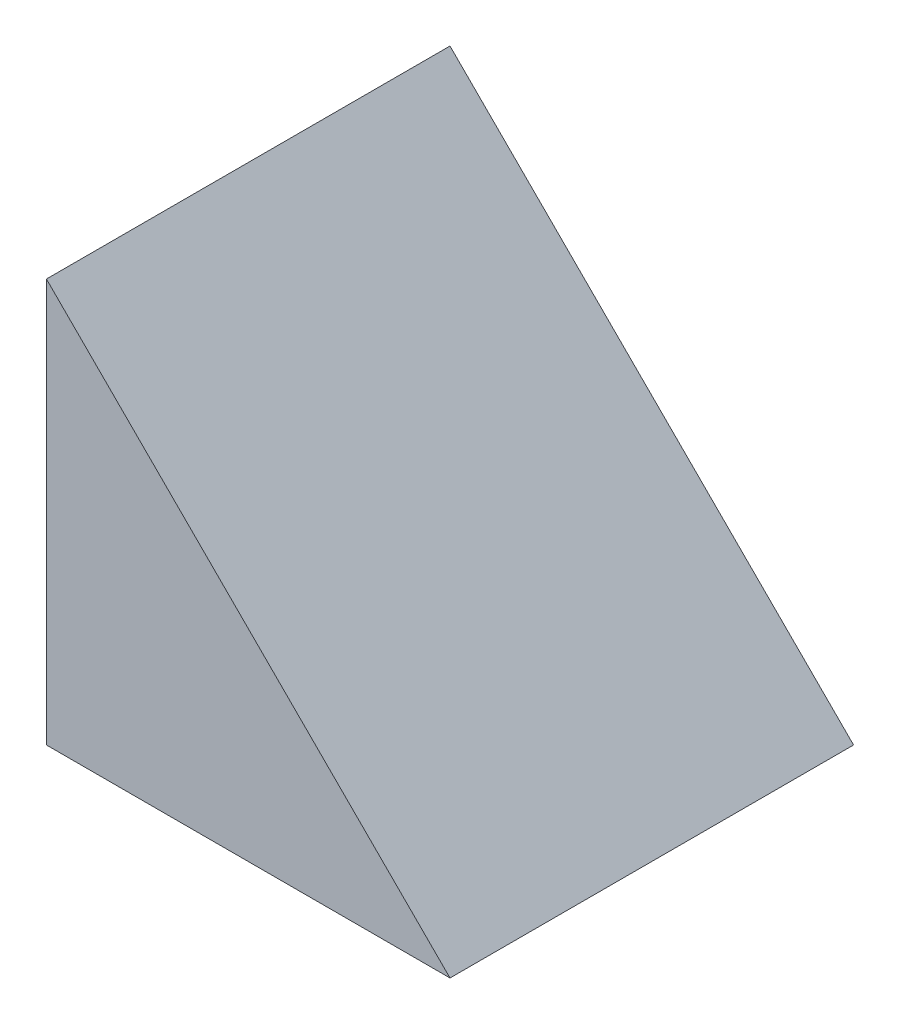
from build123d import *

# Parameters (mm, degrees)
BOSS_EXTRUDE1_DEPTH = 25.4


with BuildPart() as part:
    # Sketch1 → Boss-Extrude1 (new body)
    with BuildSketch(Plane.XY):
        Polygon((0, 0), (25.4, 0), (0, 25.4), align=None)
    extrude(amount=BOSS_EXTRUDE1_DEPTH)


solid = part.part
